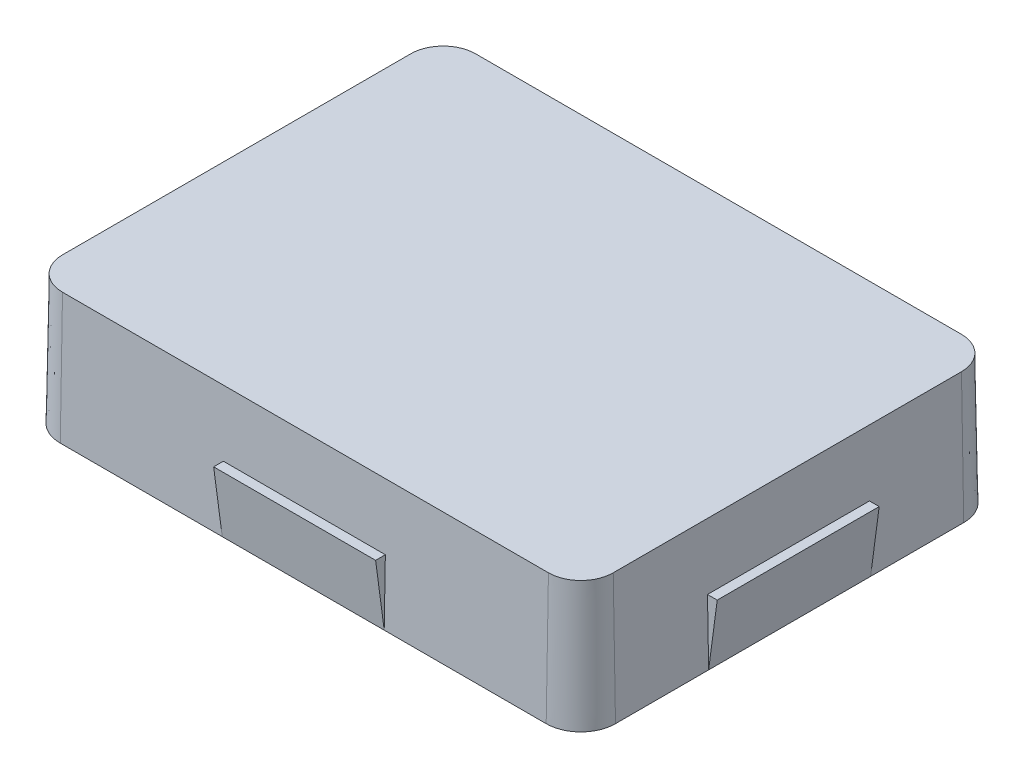
from build123d import *

# Parameters (mm, degrees)
BOSS_EXTRUDE1_DEPTH = 4
BOSS_EXTRUDE1_DRAFT = 1
SHELL1_T            = -0.5
SKETCH2_R           = 2
BOSS_EXTRUDE2_DEPTH = 5.5
BOSS_EXTRUDE2_TAPER = 1.5
CIRPATTERN1_COUNT   = 4
SKETCH4_R           = 1.605977431
CUT_EXTRUDE1_DEPTH  = 5.5
CUT_EXTRUDE1_DRAFT  = 1.5
BOSS_EXTRUDE3_DEPTH = 2.5
BOSS_EXTRUDE4_DEPTH = 2.5


with BuildPart() as part:
    # Sketch1 → Boss-Extrude1 (with draft: the straight prism first)
    with BuildSketch(Plane(origin=(0, 0, 0), x_dir=(1, 0, 0), z_dir=(0, 1, 0))):
        with BuildLine():
            Line((-7.5, -6.375), (7.5, -6.375))
            ThreePointArc((7.5, -6.375), (8.207106781, -6.082106781), (8.5, -5.375))
            Line((8.5, -5.375), (8.5, 5.375))
            ThreePointArc((8.5, 5.375), (8.207106781, 6.082106781), (7.5, 6.375))
            Line((7.5, 6.375), (-7.5, 6.375))
            ThreePointArc((-7.5, 6.375), (-8.207106781, 6.082106781), (-8.5, 5.375))
            Line((-8.5, 5.375), (-8.5, -5.375))
            ThreePointArc((-8.5, -5.375), (-8.207106781, -6.082106781), (-7.5, -6.375))
        make_face()
    extrude(amount=-BOSS_EXTRUDE1_DEPTH)
    # Boss-Extrude1: the draft: its side faces are tilted about the plane it starts from
    boss_extrude1_sides = [part.faces().sort_by_distance(p)[0] for p in [
        (0, -2, 6.375),
        (8.207106781, -2, 6.082106781),
        (8.5, -2, 0),
        (8.207106781, -2, -6.082106781),
        (0, -2, -6.375),
        (-8.207106781, -2, -6.082106781),
        (-8.5, -2, 0),
        (-8.207106781, -2, 6.082106781),
    ]]
    draft(boss_extrude1_sides, Plane(origin=(0, 0, 0), x_dir=(1, 0, 0), z_dir=(0, 1, 0)), BOSS_EXTRUDE1_DRAFT)

    # Shell1
    shell1_openings = [part.faces().sort_by_distance(p)[0] for p in [
        (0, -4, 0),
    ]]
    offset(amount=SHELL1_T, openings=shell1_openings, kind=Kind.INTERSECTION)

    # Sketch2 → Boss-Extrude2 (add)
    with BuildSketch(Plane.XZ.offset(0.5)):
        Circle(SKETCH2_R)
    extrude(amount=BOSS_EXTRUDE2_DEPTH, taper=BOSS_EXTRUDE2_TAPER)

    # Rib1: read off the stored shape, not the designer's step
    # Rib1: loft between two sections, ruled curve by curve
    rib1_from = [
        Edge.make_line((1.982008415, -0.5, 0.267661433), (3, -0.5, 0.25)),
        Edge.make_line((1.982008415, -0.5, -0.267661433), (3, -0.5, -0.25)),
        Edge.make_line((3, -0.5, -0.25), (3, -0.5, 0.25)),
        Edge.make_line((1.982008415, -0.5, -0.267661433), (1.982008415, -0.5, 0.267661433)),
    ]
    rib1_to = [
        Edge.make_line((1.837730654, -6, 0.259611763), (2.391745366, -6, 0.25)),
        Edge.make_line((1.837730654, -6, -0.259611763), (2.391745366, -6, -0.25)),
        Edge.make_line((2.391745366, -6, -0.25), (2.391745366, -6, 0.25)),
        Edge.make_line((1.837730654, -6, -0.259611763), (1.837730654, -6, 0.259611763)),
    ]
    rib1 = Solid(Shell([*[Face.make_surface_from_curves(rib1_from[k], rib1_to[k]) for k in range(4)], Face(Wire(rib1_from)), Face(Wire(rib1_to))]))
    add(rib1)

    # CirPattern1: Rib1 ×4 about axis
    cirpattern1_axis = Axis((0, 0, 0), (0, 1, 0))
    for i in range(1, CIRPATTERN1_COUNT):
        add(rib1.rotate(cirpattern1_axis, i * 360 / CIRPATTERN1_COUNT))


with BuildPart() as cut_extrude1_tool:
    # Sketch4 → Cut-Extrude1 (with draft: the straight prism first)
    with BuildSketch(Plane.XZ.offset(6)):
        Circle(SKETCH4_R)
    extrude(amount=-CUT_EXTRUDE1_DEPTH)
    # Cut-Extrude1: the draft: its side faces are tilted about the plane it starts from
    cut_extrude1_sides = [cut_extrude1_tool.faces().sort_by_distance(p)[0] for p in [
        (-1.605977431, -3.25, 0),
    ]]
    draft(cut_extrude1_sides, Plane.XZ.offset(6), CUT_EXTRUDE1_DRAFT)


with BuildPart() as part_1:
    add(part.part)

    # Cut-Extrude1: cut by cut_extrude1_tool
    add(cut_extrude1_tool.part, mode=Mode.SUBTRACT)

    # Sketch5 → Boss-Extrude3 (add, symmetric)
    with BuildSketch(Plane(origin=(0, 0, 0), x_dir=(0, 0, -1), z_dir=(1, 0, 0))):
        Polygon((6.44482026, -4), (6.40991013, -2), (6.70991013, -2), align=None)
        Polygon((-6.70991013, -2), (-6.44482026, -4), (-6.40991013, -2), align=None)
    extrude(amount=BOSS_EXTRUDE3_DEPTH, both=True)

    # Sketch6 → Boss-Extrude4 (add, symmetric)
    with BuildSketch(Plane.XY):
        Polygon((8.56982026, -4), (8.53491013, -2), (8.83491013, -2), align=None)
        Polygon((-8.83491013, -2), (-8.56982026, -4), (-8.53491013, -2), align=None)
    extrude(amount=BOSS_EXTRUDE4_DEPTH, both=True)


solid = part_1.part
